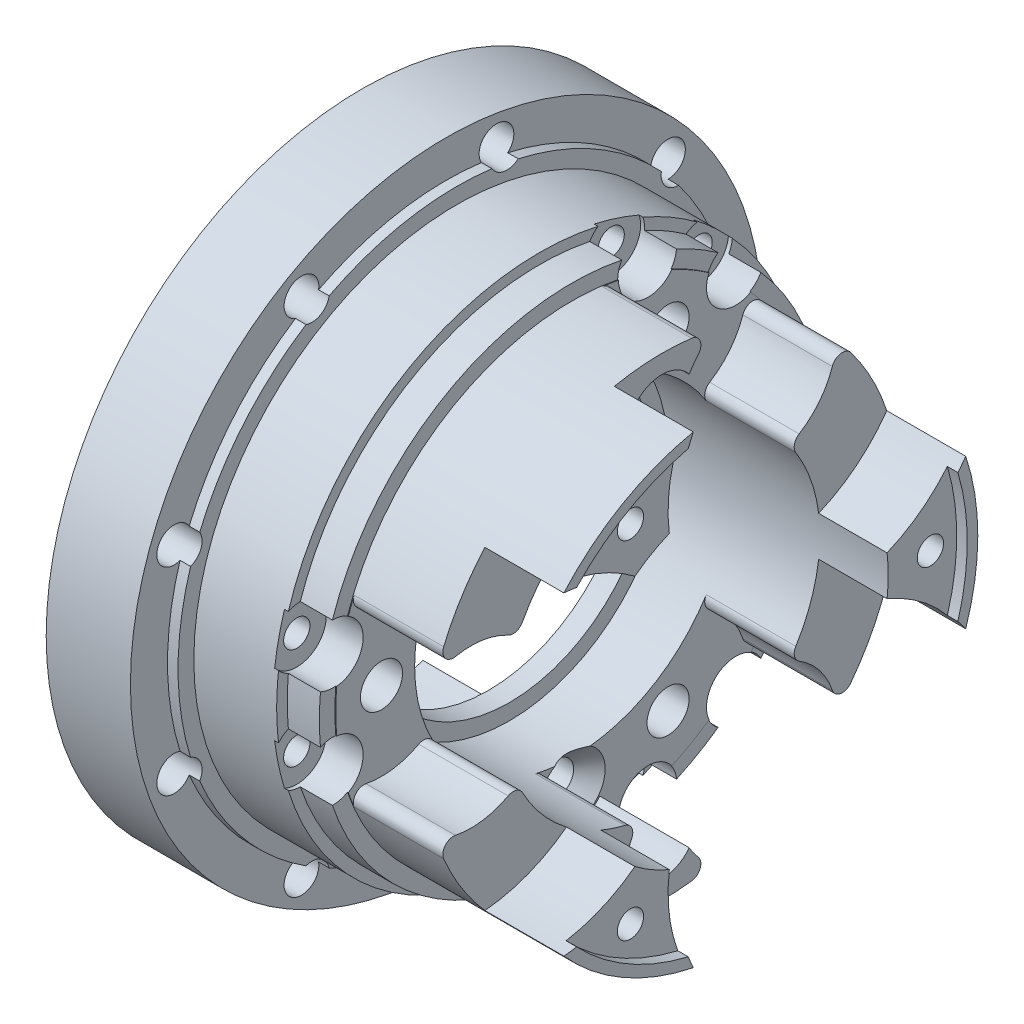
from build123d import *

# Parameters (mm, degrees)
SKETCH_2_R               = 2
SKETCH_2_R_2             = 1.25
CUT_EXTRUDE_1_DEPTH      = 56.641710973
SKETCH_4_R               = 7.5
CUT_EXTRUDE_2_DEPTH      = 16
SKETCH_5_R               = 15
CUT_EXTRUDE_3_DEPTH      = 7.5
PATTERN_CIRCULAR_1_COUNT = 3
SKETCH_6_R               = 1.6
CUT_EXTRUDE_4_DEPTH      = 49.744230428
SKETCH_7_R               = 3.25
CUT_EXTRUDE_5_DEPTH      = 8.5
CHAMFER_1_SIZE           = 1.5
CUT_EXTRUDE_6_DEPTH      = 8
SKETCH_10_R              = 1.65
CUT_EXTRUDE_7_DEPTH      = 56.641710973
PATTERN_CIRCULAR_2_COUNT = 9
FILLET_1_R               = 1
SKETCH_12_R              = 2.8
CUT_EXTRUDE_8_DEPTH      = 18.5
CUT_EXTRUDE_START        = -18.5
SKETCH_14_R              = 1.25
CUT_EXTRUDE_9_DEPTH      = 8
FILLET_2_R               = 1
PATTERN_CIRCULAR_3_COUNT = 3


with BuildPart() as part:
    # 草图1 → 旋转1 (revolve)
    with BuildSketch(Plane.XY, mode=Mode.PRIVATE) as revolve_1_sk:
        Polygon((8, 21.25), (12, 21.25), (12, 13.5), (14, 13.5), (14, 15), (35, 15), (35, 21.5), (36, 21.5), (36, 22.5), (19.92, 22.5), (19.92, 23.975), (18.62, 23.975), (16.87, 23.975), (16.87, 24.975), (9, 24.975), (9, 26.475), (8, 26.475), (8, 30), (0, 30), (0, 23), (-1, 23), (-1, 22), (8, 22), align=None)
    revolve(revolve_1_sk.sketch.rotate(Axis((0, 0, 0), (1, 0, 0)), 90), axis=Axis((0, 0, 0), (1, 0, 0)))

    # 草图2 → 切除-拉伸1 (cut, through all)
    with BuildSketch(Plane(origin=(35, 0, 0), x_dir=(0, 0, -1), z_dir=(1, 0, 0))):
        with Locations((-18.15, 0)):
            Circle(SKETCH_2_R)
        with Locations((-9.5, 16.454482672)):
            Circle(SKETCH_2_R_2)
    cut_extrude_1 = extrude(amount=-CUT_EXTRUDE_1_DEPTH, mode=Mode.SUBTRACT)

    # 草图4 → 切除-拉伸2 (cut)
    with BuildSketch(Plane(origin=(36, 0, 0), x_dir=(0, 0, -1), z_dir=(1, 0, 0))):
        with Locations((-18.15, 0)):
            Circle(SKETCH_4_R)
    cut_extrude_2 = extrude(amount=-CUT_EXTRUDE_2_DEPTH, mode=Mode.SUBTRACT)

    # 草图5 → 切除-拉伸3 (cut)
    with BuildSketch(Plane(origin=(36, 0, 0), x_dir=(0, 0, -1), z_dir=(1, 0, 0))):
        with Locations((-18.15, 0)):
            Circle(SKETCH_5_R)
    cut_extrude_3 = extrude(amount=-CUT_EXTRUDE_3_DEPTH, mode=Mode.SUBTRACT)

    # 阵列(圆周)1: 切除-拉伸1, 切除-拉伸2, 切除-拉伸3 ×3 about axis
    pattern_circular_1_axis = Axis((0, 0, 0), (1, 0, 0))
    add([cut_extrude_1.rotate(pattern_circular_1_axis, i * 360 / PATTERN_CIRCULAR_1_COUNT) for i in range(1, PATTERN_CIRCULAR_1_COUNT)], mode=Mode.SUBTRACT)
    add([cut_extrude_2.rotate(pattern_circular_1_axis, i * 360 / PATTERN_CIRCULAR_1_COUNT) for i in range(1, PATTERN_CIRCULAR_1_COUNT)], mode=Mode.SUBTRACT)
    add([cut_extrude_3.rotate(pattern_circular_1_axis, i * 360 / PATTERN_CIRCULAR_1_COUNT) for i in range(1, PATTERN_CIRCULAR_1_COUNT)], mode=Mode.SUBTRACT)

    # 草图6 → 切除-拉伸4 (cut, through all)
    with BuildSketch(Plane.ZY.offset(-12)):
        with Locations((0, 17.5)):
            Circle(SKETCH_6_R)
        with Locations((0, -17.5)):
            Circle(SKETCH_6_R)
    extrude(amount=-CUT_EXTRUDE_4_DEPTH, mode=Mode.SUBTRACT)

    # 草图7 → 切除-拉伸5 (cut)
    with BuildSketch(Plane(origin=(28.5, 0, 0), x_dir=(0, 0, -1), z_dir=(1, 0, 0))):
        with Locations((0, 17.5)):
            Circle(SKETCH_7_R)
        with Locations((0, -17.5)):
            Circle(SKETCH_7_R)
    extrude(amount=-CUT_EXTRUDE_5_DEPTH, mode=Mode.SUBTRACT)

    # 倒角1
    # the kernel refuses this chamfer: 1.5 mm, written as the material it takes off along each edge
    with BuildSketch(Plane(origin=(20, 17.5, 0), x_dir=(0, 0, 1), z_dir=(0, -1, 0))) as chamfer_1_piece_1:
        Polygon((1.6 + CHAMFER_1_SIZE, 0), (1.6, CHAMFER_1_SIZE), (1.6, 0), align=None)
    revolve(axis=Axis((20, 17.5, 0), (-1, 0, 0)), mode=Mode.SUBTRACT)
    with BuildSketch(Plane(origin=(20, -17.5, 0), x_dir=(0, 0, 1), z_dir=(0, -1, 0))) as chamfer_1_piece_2:
        Polygon((1.6 + CHAMFER_1_SIZE, 0), (1.6, CHAMFER_1_SIZE), (1.6, 0), align=None)
    revolve(axis=Axis((20, -17.5, 0), (-1, 0, 0)), mode=Mode.SUBTRACT)

    # 草图8 → 切除-拉伸6 (cut)
    with BuildSketch(Plane.ZY.offset(1)):
        with BuildLine():
            Line((0, 0), (-25.441442885, 15.897577927))
            ThreePointArc((-25.441442885, 15.897577927), (-28.190778624, -10.2606043), (-9.270509831, -28.531695489))
            Line((-9.270509831, -28.531695489), (0, 0))
        make_face()
    extrude(amount=-CUT_EXTRUDE_6_DEPTH, mode=Mode.SUBTRACT)

    # 草图10 → 切除-拉伸7 (cut, through all)
    with BuildSketch(Plane.ZY):
        with Locations((25.841547072, 9.405553941)):
            Circle(SKETCH_10_R)
    cut_extrude_7 = extrude(amount=-CUT_EXTRUDE_7_DEPTH, mode=Mode.SUBTRACT)

    # 阵列(圆周)2: 切除-拉伸7 ×9 about axis, 2 skipped
    pattern_circular_2_axis = Axis((0, 0, 0), (-1, 0, 0))
    add([cut_extrude_7.rotate(pattern_circular_2_axis, i * 360 / PATTERN_CIRCULAR_2_COUNT) for i in range(1, PATTERN_CIRCULAR_2_COUNT) if i not in (4, 5)], mode=Mode.SUBTRACT)

    # 圆角1
    fillet_1_edges = [part.edges().sort_by_distance(p)[0] for p in [
        (24.25, -8.857815947, -12.105333397),
        (24.25, -21.957187748, -4.912423659),
        (24.25, 15.232877557, -16.559270556),
        (24.25, -15.232877557, -16.559270556),
        (24.25, 21.957187748, -4.912423659),
        (24.25, 8.857815947, -12.105333397),
        (24.25, 14.876785714, 1.918657554),
        (24.25, -14.876785714, 1.918657554),
        (24.25, -6.054618269, 13.723760331),
        (24.25, 6.724310191, 21.471694215),
        (24.25, -6.724310191, 21.471694215),
        (24.25, 6.054618269, 13.723760331),
    ]]
    fillet(fillet_1_edges, radius=FILLET_1_R)

    # 草图12 → 切除-拉伸8 (cut)
    with BuildSketch(Plane(origin=(35, 0, 0), x_dir=(0, 0, -1), z_dir=(1, 0, 0))):
        with Locations((-22.693024337, -4.823551227)):
            Circle(SKETCH_12_R)
        with Locations((-22.693024337, 4.823551227)):
            Circle(SKETCH_12_R)
    cut_extrude_8 = extrude(amount=-CUT_EXTRUDE_8_DEPTH, mode=Mode.SUBTRACT)

    # 草图14 → 切除-拉伸9 (cut)
    with BuildSketch(Plane(origin=(35, 0, 0), x_dir=(0, 0, -1), z_dir=(1, 0, 0)).offset(CUT_EXTRUDE_START)):
        with Locations(Location((-22.693024337, -4.823551227, 0), (0, 0, 180))):
            Circle(SKETCH_14_R)
        with Locations(Location((-22.693024337, 4.823551227, 0), (0, 0, 180))):
            Circle(SKETCH_14_R)
    cut_extrude_9 = extrude(amount=-CUT_EXTRUDE_9_DEPTH, mode=Mode.SUBTRACT)

    # 圆角2
    fillet_2_edges = [part.edges().sort_by_distance(p)[0] for p in [
        (3.5, -28.531695489, -9.270509831),
        (3.5, 15.897577927, -25.441442885),
    ]]
    fillet(fillet_2_edges, radius=FILLET_2_R)

    # 阵列(圆周)3: 切除-拉伸8, 切除-拉伸9 ×3 about axis
    pattern_circular_3_axis = Axis((0, 0, 0), (1, 0, 0))
    add([cut_extrude_8.rotate(pattern_circular_3_axis, i * 360 / PATTERN_CIRCULAR_3_COUNT) for i in range(1, PATTERN_CIRCULAR_3_COUNT)], mode=Mode.SUBTRACT)
    add([cut_extrude_9.rotate(pattern_circular_3_axis, i * 360 / PATTERN_CIRCULAR_3_COUNT) for i in range(1, PATTERN_CIRCULAR_3_COUNT)], mode=Mode.SUBTRACT)


solid = part.part
